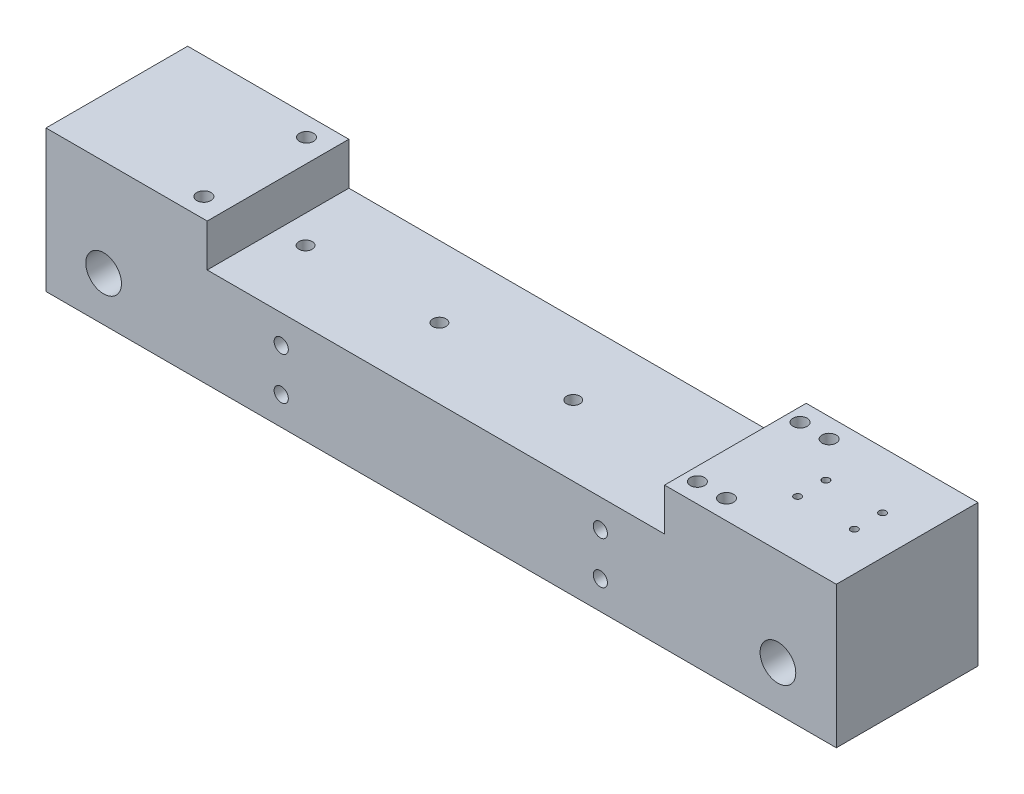
from build123d import *

# Parameters (mm, degrees)
SKETCH1_R              = 14
SKETCH1_R_2            = 2.6035
BOSS_EXTRUDE1_DEPTH    = 63.5
SKETCH2_R              = 3.175
CUT_EXTRUDE1_DEPTH     = 19.05
CUT_EXTRUDE3_START     = -63.5
CUT_EXTRUDE3_DEPTH     = 6.35
BOSS_EXTRUDE2_START    = -32
SKETCH3_R              = 14
SKETCH3_R_2            = 8
BOSS_EXTRUDE2_DEPTH    = 31.5
SKETCH4_R              = 1.5875
CUT_EXTRUDE4_DEPTH     = 6.35
BOSS_EXTRUDE3_START    = -50.8
SKETCH5_R              = 2.6035
BOSS_EXTRUDE3_DEPTH    = 50.8
CUT_EXTRUDE5_DEPTH     = 6.35
CUT_EXTRUDE6_START     = -6.35
CUT_EXTRUDE6_OUTLINE_R = 3.175
CUT_EXTRUDE6_DEPTH     = 6.35


# Read off the part's stored shape, not the designer's step: Cut-Extrude6
with BuildPart() as part:
    # Sketch1 → Boss-Extrude1 (new body)
    with BuildSketch(Plane.XY):
        Polygon((100.125, 63.5), (100.125, 44.5), (-104.875, 44.5), (-104.875, 63.5), (-177.125, 63.5), (-177.125, 0), (177.125, 0), (177.125, 63.5), align=None)
        with Locations((-151.3, 20)):
            Circle(SKETCH1_R, mode=Mode.SUBTRACT)
        with Locations((150.95, 20)):
            Circle(SKETCH1_R, mode=Mode.SUBTRACT)
        with Locations((-164.735028843, 6.564971157)):
            Circle(SKETCH1_R_2, mode=Mode.SUBTRACT)
        with Locations((-137.864971157, 6.564971157)):
            Circle(SKETCH1_R_2, mode=Mode.SUBTRACT)
        with Locations((-132.3, 20)):
            Circle(SKETCH1_R_2, mode=Mode.SUBTRACT)
        with Locations((-137.864971157, 33.435028843)):
            Circle(SKETCH1_R_2, mode=Mode.SUBTRACT)
        with Locations((-170.3, 20)):
            Circle(SKETCH1_R_2, mode=Mode.SUBTRACT)
        with Locations((-164.735028843, 33.435028843)):
            Circle(SKETCH1_R_2, mode=Mode.SUBTRACT)
        with Locations((137.514971157, 6.564971157)):
            Circle(SKETCH1_R_2, mode=Mode.SUBTRACT)
        with Locations((164.385028843, 6.564971157)):
            Circle(SKETCH1_R_2, mode=Mode.SUBTRACT)
        with Locations((169.95, 20)):
            Circle(SKETCH1_R_2, mode=Mode.SUBTRACT)
        with Locations((164.385028843, 33.435028843)):
            Circle(SKETCH1_R_2, mode=Mode.SUBTRACT)
        with Locations((131.95, 20)):
            Circle(SKETCH1_R_2, mode=Mode.SUBTRACT)
        with Locations((137.514971157, 33.435028843)):
            Circle(SKETCH1_R_2, mode=Mode.SUBTRACT)
    extrude(amount=BOSS_EXTRUDE1_DEPTH)

    # Sketch2 → Cut-Extrude1 (cut)
    with BuildSketch(Plane(origin=(0, 63.5, 0), x_dir=(1, 0, 0), z_dir=(0, 1, 0))):
        with Locations(Location((119.125, -54.75, 0), (0, 0, 180))):
            Circle(SKETCH2_R)
        with Locations(Location((106.125, -54.75, 0), (0, 0, 180))):
            Circle(SKETCH2_R)
        with Locations(Location((119.125, -8.75, 0), (0, 0, 180))):
            Circle(SKETCH2_R)
        with Locations(Location((106.125, -8.75, 0), (0, 0, 180))):
            Circle(SKETCH2_R)
        with Locations(Location((-115.125, -54.75, 0), (0, 0, 180))):
            Circle(SKETCH2_R)
        with Locations(Location((-115.125, -8.75, 0), (0, 0, 180))):
            Circle(SKETCH2_R)
    extrude(amount=-CUT_EXTRUDE1_DEPTH, mode=Mode.SUBTRACT)

    # Sketch2<3> → Cut-Extrude3 (cut)
    with BuildSketch(Plane(origin=(0, 63.5, 0), x_dir=(1, 0, 0), z_dir=(0, 1, 0)).offset(CUT_EXTRUDE3_START)):
        with BuildLine():
            ThreePointArc((169.525, -34.65), (171.625, -36.75), (173.725, -34.65))
            ThreePointArc((173.725, -34.65), (171.625, -32.55), (169.525, -34.65))
        make_face()
        with BuildLine():
            ThreePointArc((128.525, -34.65), (130.625, -36.75), (132.725, -34.65))
            ThreePointArc((132.725, -34.65), (130.625, -32.55), (128.525, -34.65))
        make_face()
        with BuildLine():
            ThreePointArc((128.525, -8.65), (130.625, -10.75), (132.725, -8.65))
            ThreePointArc((132.725, -8.65), (130.625, -6.55), (128.525, -8.65))
        make_face()
        with BuildLine():
            ThreePointArc((169.525, -8.65), (171.625, -10.75), (173.725, -8.65))
            ThreePointArc((173.725, -8.65), (171.625, -6.55), (169.525, -8.65))
        make_face()
        with BuildLine():
            ThreePointArc((-132.725, -34.65), (-130.625, -36.75), (-128.525, -34.65))
            ThreePointArc((-128.525, -34.65), (-130.625, -32.55), (-132.725, -34.65))
        make_face()
        with BuildLine():
            ThreePointArc((-132.725, -8.65), (-130.625, -10.75), (-128.525, -8.65))
            ThreePointArc((-128.525, -8.65), (-130.625, -6.55), (-132.725, -8.65))
        make_face()
        with BuildLine():
            ThreePointArc((-173.725, -8.65), (-171.625, -10.75), (-169.525, -8.65))
            ThreePointArc((-169.525, -8.65), (-171.625, -6.55), (-173.725, -8.65))
        make_face()
        with BuildLine():
            ThreePointArc((-173.725, -34.65), (-171.625, -36.75), (-169.525, -34.65))
            ThreePointArc((-169.525, -34.65), (-171.625, -32.55), (-173.725, -34.65))
        make_face()
    extrude(amount=CUT_EXTRUDE3_DEPTH, mode=Mode.SUBTRACT)

    # Sketch3 → Boss-Extrude2 (add)
    # profile 1 of 2: a face of its own
    with BuildSketch(Plane(origin=(0, 0, 0), x_dir=(-1, 0, 0), z_dir=(0, 0, -1)).offset(BOSS_EXTRUDE2_START)):
        with Locations(Location((-150.95, 20, 0), (0, 0, 180))):
            Circle(SKETCH3_R)
        with Locations(Location((-150.95, 20, 0), (0, 0, 180))):
            Circle(SKETCH3_R_2, mode=Mode.SUBTRACT)
    # profile 2 of 2: a face of its own
    with BuildSketch(Plane(origin=(0, 0, 0), x_dir=(-1, 0, 0), z_dir=(0, 0, -1)).offset(BOSS_EXTRUDE2_START)):
        with Locations(Location((151.3, 20, 0), (0, 0, 180))):
            Circle(SKETCH3_R)
        with Locations(Location((151.3, 20, 0), (0, 0, 180))):
            Circle(SKETCH3_R_2, mode=Mode.SUBTRACT)
    extrude(amount=-BOSS_EXTRUDE2_DEPTH)

    # Sketch4 → Cut-Extrude4 (cut)
    with BuildSketch(Plane(origin=(0, 63.5, 0), x_dir=(1, 0, 0), z_dir=(0, 1, 0))):
        with Locations(Location((159.775, -38.075, 0), (0, 0, 180))):
            Circle(SKETCH4_R)
        with Locations(Location((159.775, -25.425, 0), (0, 0, 180))):
            Circle(SKETCH4_R)
        with Locations(Location((134.375, -25.425, 0), (0, 0, 180))):
            Circle(SKETCH4_R)
        with Locations(Location((134.375, -38.075, 0), (0, 0, 180))):
            Circle(SKETCH4_R)
    extrude(amount=-CUT_EXTRUDE4_DEPTH, mode=Mode.SUBTRACT)

    # Sketch5 → Boss-Extrude3 (add)
    with BuildSketch(Plane.XY.offset(63.5).offset(BOSS_EXTRUDE3_START)):
        with Locations((131.95, 20)):
            Circle(SKETCH5_R)
        with Locations((137.514971157, 6.564971157)):
            Circle(SKETCH5_R)
        with Locations((164.385028843, 6.564971157)):
            Circle(SKETCH5_R)
        with Locations((169.95, 20)):
            Circle(SKETCH5_R)
        with Locations((164.385028843, 33.435028843)):
            Circle(SKETCH5_R)
        with Locations((137.514971157, 33.435028843)):
            Circle(SKETCH5_R)
        with Locations((-137.864971157, 6.564971157)):
            Circle(SKETCH5_R)
        with Locations((-132.3, 20)):
            Circle(SKETCH5_R)
        with Locations((-137.864971157, 33.435028843)):
            Circle(SKETCH5_R)
        with Locations((-164.735028843, 6.564971157)):
            Circle(SKETCH5_R)
        with Locations((-170.3, 20)):
            Circle(SKETCH5_R)
        with Locations((-164.735028843, 33.435028843)):
            Circle(SKETCH5_R)
    extrude(amount=BOSS_EXTRUDE3_DEPTH)

    # Sketch6 → Cut-Extrude5 (cut)
    with BuildSketch(Plane(origin=(0, 44.5, 0), x_dir=(1, 0, 0), z_dir=(0, 1, 0))):
        with BuildLine():
            ThreePointArc((87.625, -34.925), (90.625, -31.925), (87.625, -28.925))
            ThreePointArc((87.625, -28.925), (84.625, -31.925), (87.625, -34.925))
        make_face()
        with BuildLine():
            ThreePointArc((27.625, -34.925), (30.625, -31.925), (27.625, -28.925))
            ThreePointArc((27.625, -28.925), (24.625, -31.925), (27.625, -34.925))
        make_face()
        with BuildLine():
            ThreePointArc((-32.3698, -34.925), (-29.3698, -31.925), (-32.3698, -28.925))
            ThreePointArc((-32.3698, -28.925), (-35.3698, -31.925), (-32.3698, -34.925))
        make_face()
        with BuildLine():
            ThreePointArc((-92.3646, -34.925), (-89.3646, -31.925), (-92.3646, -28.925))
            ThreePointArc((-92.3646, -28.925), (-95.3646, -31.925), (-92.3646, -34.925))
        make_face()
    extrude(amount=-CUT_EXTRUDE5_DEPTH, mode=Mode.SUBTRACT)

    # Cut-Extrude6 outline → Cut-Extrude6 (cut)
    with BuildSketch(Plane.XY.offset(63.5).offset(CUT_EXTRUDE6_START)):
        with Locations((-71.6887, 31.8)):
            Circle(CUT_EXTRUDE6_OUTLINE_R)
        with Locations((71.3387, 12.75)):
            Circle(CUT_EXTRUDE6_OUTLINE_R)
        with Locations((71.3387, 31.8)):
            Circle(CUT_EXTRUDE6_OUTLINE_R)
        with Locations((-71.6887, 12.75)):
            Circle(CUT_EXTRUDE6_OUTLINE_R)
    extrude(amount=CUT_EXTRUDE6_DEPTH, mode=Mode.SUBTRACT)


solid = part.part
